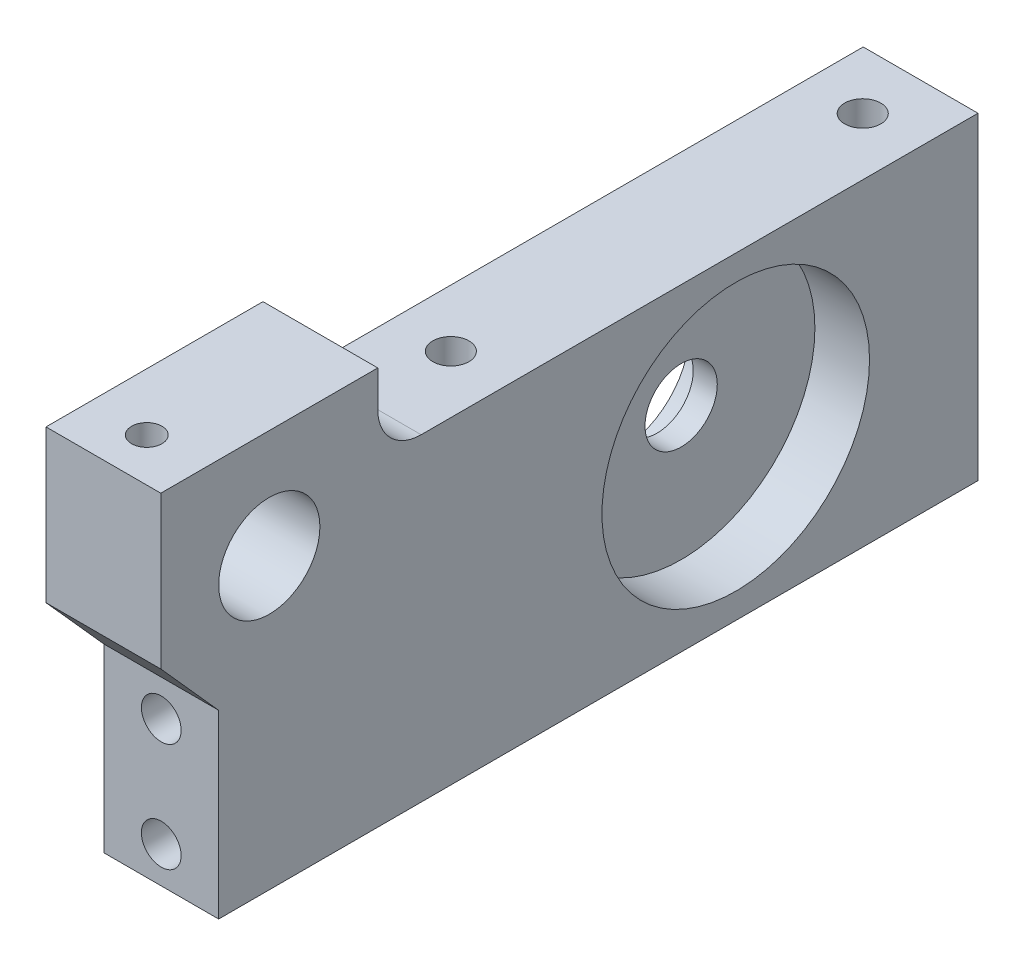
from build123d import *

# Parameters (mm, degrees)
ESBO_O1_R                                            = 7
RESSALTO_EXTRUS_O1_DEPTH                             = 7.9375
ESCAREADO_PARA_PARAFUSO_DE_M_QUINA_COM_C_D           = 5.5
ESCAREADO_PARA_PARAFUSO_DE_M_QUINA_COM_C_DEPTH       = 30
ESCAREADO_PARA_PARAFUSO_DE_M_QUINA_COM_C_CSINK_D     = 10.4
ESCAREADO_PARA_PARAFUSO_DE_M_QUINA_COM_C_CSINK_ANGLE = 90
ESCAREADO_PARA_PARAFUSO_DE_M_QUINA_COM_C_TIP         = 1.652366702
ESCAREADO_PARA_PARAFUSO_DE_M_QUINA_C_2_D             = 6.6
ESCAREADO_PARA_PARAFUSO_DE_M_QUINA_C_2_DEPTH         = 30
ESCAREADO_PARA_PARAFUSO_DE_M_QUINA_C_2_CSINK_D       = 12.6
ESCAREADO_PARA_PARAFUSO_DE_M_QUINA_C_2_CSINK_ANGLE   = 90
ESCAREADO_PARA_PARAFUSO_DE_M_QUINA_C_2_TIP           = 1.982840043
BROCA_DE_ROSQUEAR_PARA_TARRAXA_DE_M5X0_8_D           = 4.2
BROCA_DE_ROSQUEAR_PARA_TARRAXA_DE_M5X0_8_DEPTH       = 20
BROCA_DE_ROSQUEAR_PARA_TARRAXA_DE_M5X0_8_TIP         = 1.2618073
BROCA_DE_ROSQUEAR_PARA_TARRAXA_DE_M5_2_D             = 4.2
BROCA_DE_ROSQUEAR_PARA_TARRAXA_DE_M5_2_DEPTH         = 20
BROCA_DE_ROSQUEAR_PARA_TARRAXA_DE_M5_2_TIP           = 1.2618073
BROCA_DE_ROSQUEAR_PARA_TARRAXA_DE_M6X1_0_D           = 5
BROCA_DE_ROSQUEAR_PARA_TARRAXA_DE_M6X1_0_DEPTH       = 15
BROCA_DE_ROSQUEAR_PARA_TARRAXA_DE_M6X1_0_TIP         = 1.502151548
ESCAREADO_PARA_SFHCS_M51_AT_2_COUNT                  = 2
ESCAREADO_PARA_SFHCS_M51_AT_2_PITCH                  = 12
ESCAREADO_PARA_SFHCS_M51_AT_3_COUNT                  = 2
ESCAREADO_PARA_SFHCS_M51_AT_3_PITCH                  = 67.209946437
ESCAREADO_PARA_SFHCS_M51_AT_4_COUNT                  = 2
ESCAREADO_PARA_SFHCS_M51_AT_4_PITCH                  = 66.13
SKETCH1_R                                            = 18.5
CUT_EXTRUDE1_DEPTH                                   = 7.55
SKETCH2_R                                            = 5
CUT_EXTRUDE2_DEPTH                                   = 107.175824146
SKETCH3_R                                            = 9.5
CUT_EXTRUDE3_DEPTH                                   = 5
FILLET1_R                                            = 6


with BuildPart() as part:
    # Esboço1 → Ressalto-extrusão1 (new, symmetric)
    with BuildSketch(Plane(origin=(0, 0, 0), x_dir=(0, 0, -1), z_dir=(1, 0, 0))):
        Polygon((15, 15), (-15, 15), (-15, -6.05572809), (-7, -15), (-7, -40), (98, -40), (98, 4), (15, 4), align=None)
        Circle(ESBO_O1_R, mode=Mode.SUBTRACT)
    extrude(amount=RESSALTO_EXTRUS_O1_DEPTH, both=True)

    # Escareado para parafuso de m_quina com c
    with Locations(Plane(origin=(-33.0625, -33.751665499, 15.070399895), x_dir=(1, 0, 0), z_dir=(0, 0, 1))):
        with Locations((-33.0625, 13.751665499), (-33.0625, -1.248334501), (33.0625, -1.248334501), (33.0625, 13.751665499)):
            CounterSinkHole(ESCAREADO_PARA_PARAFUSO_DE_M_QUINA_COM_C_D / 2, ESCAREADO_PARA_PARAFUSO_DE_M_QUINA_COM_C_CSINK_D / 2, depth=ESCAREADO_PARA_PARAFUSO_DE_M_QUINA_COM_C_DEPTH, counter_sink_angle=ESCAREADO_PARA_PARAFUSO_DE_M_QUINA_COM_C_CSINK_ANGLE)
            with Locations((0, 0, -(ESCAREADO_PARA_PARAFUSO_DE_M_QUINA_COM_C_DEPTH + ESCAREADO_PARA_PARAFUSO_DE_M_QUINA_COM_C_TIP / 2))):  # 118° drill point
                Cone(0, ESCAREADO_PARA_PARAFUSO_DE_M_QUINA_COM_C_D / 2, ESCAREADO_PARA_PARAFUSO_DE_M_QUINA_COM_C_TIP, mode=Mode.SUBTRACT)

    # Escareado para parafuso de m_quina c 2
    with Locations(Plane(origin=(-33.0625, -47, -36.460196829), x_dir=(-1, 0, 0), z_dir=(0, -1, 0))):
        with Locations((33.06, 49.586524306), (33.06, -3.413475694), (-33.06, -3.413475694), (-33.06, 53.539803171)):
            CounterSinkHole(ESCAREADO_PARA_PARAFUSO_DE_M_QUINA_C_2_D / 2, ESCAREADO_PARA_PARAFUSO_DE_M_QUINA_C_2_CSINK_D / 2, depth=ESCAREADO_PARA_PARAFUSO_DE_M_QUINA_C_2_DEPTH, counter_sink_angle=ESCAREADO_PARA_PARAFUSO_DE_M_QUINA_C_2_CSINK_ANGLE)
            with Locations((0, 0, -(ESCAREADO_PARA_PARAFUSO_DE_M_QUINA_C_2_DEPTH + ESCAREADO_PARA_PARAFUSO_DE_M_QUINA_C_2_TIP / 2))):  # 118° drill point
                Cone(0, ESCAREADO_PARA_PARAFUSO_DE_M_QUINA_C_2_D / 2, ESCAREADO_PARA_PARAFUSO_DE_M_QUINA_C_2_TIP, mode=Mode.SUBTRACT)

    # Broca de rosquear para tarraxa de M5x0.8
    with Locations(Plane(origin=(-33.0625, 25, -36.460196829), x_dir=(1, 0, 0), z_dir=(0, 1, 0))):
        with Locations((33.06, -45.460196829), (-33.065, -45.460196829)):
            Hole(BROCA_DE_ROSQUEAR_PARA_TARRAXA_DE_M5X0_8_D / 2, depth=BROCA_DE_ROSQUEAR_PARA_TARRAXA_DE_M5X0_8_DEPTH)
            with Locations((0, 0, -(BROCA_DE_ROSQUEAR_PARA_TARRAXA_DE_M5X0_8_DEPTH + BROCA_DE_ROSQUEAR_PARA_TARRAXA_DE_M5X0_8_TIP / 2))):  # 118° drill point
                Cone(0, BROCA_DE_ROSQUEAR_PARA_TARRAXA_DE_M5X0_8_D / 2, BROCA_DE_ROSQUEAR_PARA_TARRAXA_DE_M5X0_8_TIP, mode=Mode.SUBTRACT)

    # Broca de rosquear para tarraxa de M5 2
    with Locations(Plane(origin=(-33.0625, -33.751665499, -25), x_dir=(-1, 0, 0), z_dir=(0, 0, -1))):
        with Locations((-33.06, 43.751665499), (33.065, 43.751665499)):
            Hole(BROCA_DE_ROSQUEAR_PARA_TARRAXA_DE_M5_2_D / 2, depth=BROCA_DE_ROSQUEAR_PARA_TARRAXA_DE_M5_2_DEPTH)
            with Locations((0, 0, -(BROCA_DE_ROSQUEAR_PARA_TARRAXA_DE_M5_2_DEPTH + BROCA_DE_ROSQUEAR_PARA_TARRAXA_DE_M5_2_TIP / 2))):  # 118° drill point
                Cone(0, BROCA_DE_ROSQUEAR_PARA_TARRAXA_DE_M5_2_D / 2, BROCA_DE_ROSQUEAR_PARA_TARRAXA_DE_M5_2_TIP, mode=Mode.SUBTRACT)

    # Broca de rosquear para tarraxa de M6x1.01
    with Locations(Plane(origin=(-33.0625, 4, -36.460196829), x_dir=(1, 0, 0), z_dir=(0, 1, 0))):
        with Locations((33.06, 53.539803171), (-33.06, 49.539803171), (-33.06, -3.413475694), (33.06, -3.413475694)):
            Hole(BROCA_DE_ROSQUEAR_PARA_TARRAXA_DE_M6X1_0_D / 2, depth=BROCA_DE_ROSQUEAR_PARA_TARRAXA_DE_M6X1_0_DEPTH)
            with Locations((0, 0, -(BROCA_DE_ROSQUEAR_PARA_TARRAXA_DE_M6X1_0_DEPTH + BROCA_DE_ROSQUEAR_PARA_TARRAXA_DE_M6X1_0_TIP / 2))):  # 118° drill point
                Cone(0, BROCA_DE_ROSQUEAR_PARA_TARRAXA_DE_M6X1_0_D / 2, BROCA_DE_ROSQUEAR_PARA_TARRAXA_DE_M6X1_0_TIP, mode=Mode.SUBTRACT)

    # Esboço23 → Escareado para SFHCS M51 (revolve, cut)
    with BuildSketch(Plane(origin=(0.0025, -57, -22), x_dir=(0, 0, -1), z_dir=(1, 0, 0))):
        Polygon((0, 0), (0, 31.652366702), (2.75, 30), (2.75, 3.35), (5.6, 0.5), (5.6, 0), align=None)
    escareado_para_sfhcs_m51 = revolve(axis=Axis((0.0025, -63.35, -22), (0, 1, 0)), mode=Mode.SUBTRACT)

    # Escareado para SFHCS M51 at 2: Escareado para SFHCS M51 ×2
    with Locations(*[(0, 0, i * ESCAREADO_PARA_SFHCS_M51_AT_2_PITCH) for i in range(1, ESCAREADO_PARA_SFHCS_M51_AT_2_COUNT)]):
        add(escareado_para_sfhcs_m51, mode=Mode.SUBTRACT)

    # Escareado para SFHCS M51 at 3: Escareado para SFHCS M51 ×2
    with Locations(*[Vector(-0.9839317468056482, 0, 0.17854500168861012) * (i * ESCAREADO_PARA_SFHCS_M51_AT_3_PITCH) for i in range(1, ESCAREADO_PARA_SFHCS_M51_AT_3_COUNT)]):
        add(escareado_para_sfhcs_m51, mode=Mode.SUBTRACT)

    # Escareado para SFHCS M51 at 4: Escareado para SFHCS M51 ×2
    with Locations(*[(-i * ESCAREADO_PARA_SFHCS_M51_AT_4_PITCH, 0, 0) for i in range(1, ESCAREADO_PARA_SFHCS_M51_AT_4_COUNT)]):
        add(escareado_para_sfhcs_m51, mode=Mode.SUBTRACT)

    # Sketch1 → Cut-Extrude1 (cut)
    with BuildSketch(Plane(origin=(7.9375, 0, 0), x_dir=(0, 0, -1), z_dir=(1, 0, 0))):
        with Locations((64.5, -18)):
            Circle(SKETCH1_R)
    extrude(amount=-CUT_EXTRUDE1_DEPTH, mode=Mode.SUBTRACT)

    # Sketch2 → Cut-Extrude2 (cut, through all)
    with BuildSketch(Plane(origin=(0.3875, 0, 0), x_dir=(0, 0, -1), z_dir=(1, 0, 0))):
        with Locations((64.5, -18)):
            Circle(SKETCH2_R)
    extrude(amount=-CUT_EXTRUDE2_DEPTH, mode=Mode.SUBTRACT)

    # Sketch3 → Cut-Extrude3 (cut)
    with BuildSketch(Plane.ZY.offset(7.9375)):
        with Locations((-64.5, -18)):
            Circle(SKETCH3_R)
    extrude(amount=-CUT_EXTRUDE3_DEPTH, mode=Mode.SUBTRACT)

    # Fillet1
    # the kernel refuses this fillet: 6 mm, written as the material it adds along each edge
    with BuildSketch(Plane(origin=(7.9375, 4, -15), x_dir=(0, 1, 0), z_dir=(-1, 0, 0))) as fillet1_piece_1_section:
        with BuildLine():
            CenterArc((FILLET1_R, FILLET1_R), FILLET1_R, 180, 90)
            Line((0, FILLET1_R), (0, 0))
            Line((0, 0), (FILLET1_R, 0))
        make_face()
    fillet1_piece_1 = extrude(amount=15.875, mode=Mode.PRIVATE)
    fillet1_piece_1 = fillet1_piece_1 - Plane(origin=(-0.0025, 10, -16.372210647), x_dir=(1, 0, 0), z_dir=(0, 0, 1)) * Cylinder(2.1, 56, mode=Mode.PRIVATE)
    add(fillet1_piece_1)


solid = part.part
